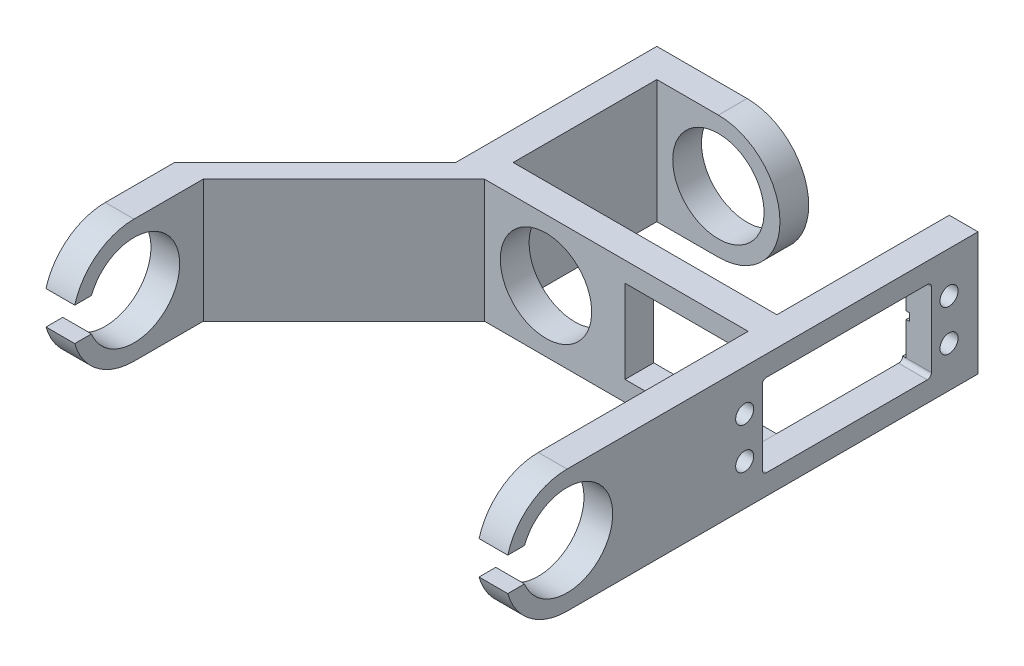
from build123d import *

# Parameters (mm, degrees)
SKETCH1_W               = 7
SKETCH1_H               = 2
SKETCH1_H_2             = 22.25
BOSS_EXTRUDE1_DEPTH     = 15
CUT_EXTRUDE1_DEPTH      = 129.379320765
CUT_EXTRUDE1_DEPTH_BACK = 129.379320765
SKETCH2_R               = 11.125
SKETCH3_R               = 11.125
CUT_EXTRUDE2_DEPTH      = 7
SKETCH6_W               = 30
SKETCH6_H               = 20.3
CUT_EXTRUDE3_DEPTH      = 7
SKETCH7_R               = 2.2
CUT_EXTRUDE4_DEPTH      = 10
CAVITY3_START           = 49.25
CAVITY3_DEPTH           = 0.842
CAVITY3_2_DEPTH         = 6.6275
CAVITY3_START_2         = 55.8775
CAVITY3_3_DEPTH         = 0.3725
CAVITY3_START_3         = -0.9135
CAVITY3_4_DEPTH         = 1.827
CUT_EXTRUDE5_DEPTH      = 10
CUT_EXTRUDE6_DEPTH      = 0.842
CUT_EXTRUDE7_START      = -7.105
SKETCH10_W              = 0.812
SKETCH10_H              = 1.827
CUT_EXTRUDE7_DEPTH      = 7.105
SKETCH11_W              = 7
SKETCH11_H              = 30
BOSS_EXTRUDE2_DEPTH     = 42
CAVITY4_START           = 49.25
CAVITY4_DEPTH           = 7
CAVITY4_2_DEPTH         = 6.6275
CAVITY4_3_DEPTH         = 0.842
CAVITY4_START_2         = -0.9135
CAVITY4_4_DEPTH         = 1.827
CUT_EXTRUDE8_DEPTH      = 42
MIRROR3_COPY_1_SKETCH_R = 2.2
MIRROR3_COPY_1_DEPTH    = 10
MIRROR3_COPY_2_SKETCH_R = 2.2
MIRROR3_COPY_2_DEPTH    = 10
MIRROR3_COPY_3_DEPTH    = 0.842
CUT_EXTRUDE9_DEPTH      = 42
BOSS_EXTRUDE3_DEPTH     = 30
SKETCH15_R              = 11.125
BOSS_EXTRUDE4_DEPTH     = 7
BOSS_EXTRUDE5_REACH     = 131.007
SKETCH16_W              = 7
SKETCH16_H              = 30
SKETCH17_W              = 9.798681855
SKETCH17_H              = 8.1
CUT_EXTRUDE10_DEPTH     = 153.595052344


with BuildPart() as part:
    # Sketch1 → Boss-Extrude1 (new, symmetric)
    with BuildSketch(Plane(origin=(0, 0, 0), x_dir=(1, 0, 0), z_dir=(0, 1, 0))):
        with Locations((-52.75, -12.125)):
            Rectangle(SKETCH1_W, SKETCH1_H)
        with Locations((-52.75, 0)):
            Rectangle(SKETCH1_W, SKETCH1_H_2)
        Polygon((-49.25, 11.125), (-49.25, 53), (49.25, 53), (49.25, 11.125), (56.25, 11.125), (56.25, 60), (-56.25, 60), (-56.25, 11.125), align=None)
        with Locations((52.75, 0)):
            Rectangle(SKETCH1_W, SKETCH1_H_2)
        with Locations((52.75, -12.125)):
            Rectangle(SKETCH1_W, SKETCH1_H)
    extrude(amount=BOSS_EXTRUDE1_DEPTH, both=True)

    # Sketch2 → Cut-Extrude1 (cut, two sides: drawn at the far end of the back side and taken through both)
    with BuildSketch(Plane.ZY.offset(56.25).offset(-CUT_EXTRUDE1_DEPTH_BACK)):
        with Locations((-1.875, 0)):
            Circle(SKETCH2_R)
        with BuildLine():
            Line((13.125, 15), (-1.875, 15))
            ThreePointArc((-1.875, 15), (8.731601718, 10.606601718), (13.125, 0))
            Line((13.125, 0), (13.125, 15))
        make_face()
        with BuildLine():
            Line((13.125, -15), (13.125, 0))
            ThreePointArc((13.125, 0), (8.731601718, -10.606601718), (-1.875, -15))
            Line((-1.875, -15), (13.125, -15))
        make_face()
    extrude(amount=CUT_EXTRUDE1_DEPTH + CUT_EXTRUDE1_DEPTH_BACK, mode=Mode.SUBTRACT)

    # Sketch3 → Cut-Extrude2 (cut)
    with BuildSketch(Plane(origin=(0, 0, -60), x_dir=(-1, 0, 0), z_dir=(0, 0, -1))):
        Circle(SKETCH3_R)
    extrude(amount=-CUT_EXTRUDE2_DEPTH, mode=Mode.SUBTRACT)

    # Sketch6 → Cut-Extrude3 (cut)
    with BuildSketch(Plane(origin=(0, 0, -60), x_dir=(-1, 0, 0), z_dir=(0, 0, -1))):
        with Locations((-34.25, 0)):
            Rectangle(SKETCH6_W, SKETCH6_H)
    extrude(amount=-CUT_EXTRUDE3_DEPTH, mode=Mode.SUBTRACT)

    # Sketch7 → Cut-Extrude4 (cut)
    with BuildSketch(Plane.ZY.offset(-49.25)):
        with Locations((-45.160353728, 5)):
            Circle(SKETCH7_R)
    cut_extrude4 = extrude(amount=-CUT_EXTRUDE4_DEPTH, mode=Mode.SUBTRACT)

    # Cavity3: read off the stored shape, not the designer's step
    # Cavity3 outline → Cavity3 (cut)
    with BuildSketch(Plane.YZ.offset(CAVITY3_START)):
        with BuildLine():
            Line((-3.80625, -42.340467029), (-3.80625, -42.949467029))
            ThreePointArc((-3.80625, -42.949467029), (-5.075, -47.020009529), (-6.34375, -42.949467029))
            Line((-6.34375, -42.949467029), (-6.34375, -42.340467029))
            Line((-6.34375, -42.340467029), (-8.0185, -42.340467029))
            ThreePointArc((-8.0185, -42.340467029), (-8.736213383, -42.637753646), (-9.0335, -43.355467029))
            Line((-9.0335, -43.355467029), (-9.0335, -49.445467029))
            Line((-9.0335, -49.445467029), (9.0335, -49.445467029))
            Line((9.0335, -49.445467029), (9.0335, -43.355467029))
            ThreePointArc((9.0335, -43.355467029), (8.736213383, -42.637753646), (8.0185, -42.340467029))
            Line((8.0185, -42.340467029), (6.34375, -42.340467029))
            Line((6.34375, -42.340467029), (6.34375, -42.949467029))
            ThreePointArc((6.34375, -42.949467029), (7.209542976, -44.131254024), (7.156577631, -45.595293863))
            ThreePointArc((7.156577631, -45.595293863), (4.566705044, -47.317262507), (2.842761328, -44.728704204))
            ThreePointArc((2.842761328, -44.728704204), (3.111418667, -43.723695206), (3.80625, -42.949467029))
            Line((3.80625, -42.949467029), (3.80625, -42.340467029))
            Line((3.80625, -42.340467029), (-3.80625, -42.340467029))
        make_face()
    extrude(amount=CAVITY3_DEPTH, mode=Mode.SUBTRACT)

    # Cavity3 2 outline → Cavity3 2 (cut)
    with BuildSketch(Plane.YZ.offset(CAVITY3_START)):
        with BuildLine():
            ThreePointArc((10.0485, -50.460467029), (9.751213383, -49.742753646), (9.0335, -49.445467029))
            Line((9.0335, -49.445467029), (-9.0335, -49.445467029))
            ThreePointArc((-9.0335, -49.445467029), (-9.751213383, -49.742753646), (-10.0485, -50.460467029))
            Line((-10.0485, -50.460467029), (-10.0485, -60))
            Line((-10.0485, -60), (10.0485, -60))
            Line((10.0485, -60), (10.0485, -50.460467029))
        make_face()
    extrude(amount=CAVITY3_2_DEPTH, mode=Mode.SUBTRACT)

    # Cavity3 3 outline → Cavity3 3 (cut)
    with BuildSketch(Plane.YZ.offset(CAVITY3_START_2)):
        with BuildLine():
            Line((-9.744, -60), (9.744, -60))
            Line((9.744, -60), (9.744, -50.511217029))
            ThreePointArc((9.744, -50.511217029), (9.521035037, -49.972931992), (8.98275, -49.749967029))
            Line((8.98275, -49.749967029), (-8.98275, -49.749967029))
            ThreePointArc((-8.98275, -49.749967029), (-9.521035037, -49.972931992), (-9.744, -50.511217029))
            Line((-9.744, -50.511217029), (-9.744, -60))
        make_face()
    extrude(amount=CAVITY3_3_DEPTH, mode=Mode.SUBTRACT)

    # Cavity3 4 outline → Cavity3 4 (cut)
    with BuildSketch(Plane(origin=(0, 0, 0), x_dir=(1, 0, 0), z_dir=(0, 1, 0)).offset(CAVITY3_START_3)):
        Polygon((50.092, 49.445467029), (50.092, 42.340467029), (50.904, 49.445467029), align=None)
    extrude(amount=CAVITY3_4_DEPTH, mode=Mode.SUBTRACT)

    # Mirror1: Cut-Extrude4 across plane
    add(cut_extrude4.mirror(Plane.ZX), mode=Mode.SUBTRACT)

    # Sketch8 → Cut-Extrude5 (cut)
    with BuildSketch(Plane.ZY.offset(-55.8775)):
        with BuildLine():
            Line((-60, -10.0485), (-50.460467029, -10.0485))
            ThreePointArc((-50.460467029, -10.0485), (-49.742753646, -9.751213383), (-49.445467029, -9.0335))
            Line((-49.445467029, -9.0335), (-49.445467029, 9.0335))
            ThreePointArc((-49.445467029, 9.0335), (-49.742753646, 9.751213383), (-50.460467029, 10.0485))
            Line((-50.460467029, 10.0485), (-60, 10.0485))
            Line((-60, 10.0485), (-60, 9.744))
            Line((-60, 9.744), (-50.511217029, 9.744))
            ThreePointArc((-50.511217029, 9.744), (-49.972931992, 9.521035037), (-49.749967029, 8.98275))
            Line((-49.749967029, 8.98275), (-49.749967029, -8.98275))
            ThreePointArc((-49.749967029, -8.98275), (-49.972931992, -9.521035037), (-50.511217029, -9.744))
            Line((-50.511217029, -9.744), (-60, -9.744))
            Line((-60, -9.744), (-60, -10.0485))
        make_face()
    cut_extrude5 = extrude(amount=-CUT_EXTRUDE5_DEPTH, mode=Mode.SUBTRACT)

    # Sketch9 → Cut-Extrude6 (cut)
    with BuildSketch(Plane.ZY.offset(-49.25)):
        with BuildLine():
            Line((-42.340467029, 6.34375), (-42.340467029, 3.80625))
            Line((-42.340467029, 3.80625), (-42.949467029, 3.80625))
            ThreePointArc((-42.949467029, 3.80625), (-43.723695206, 3.111418667), (-44.728704204, 2.842761328))
            ThreePointArc((-44.728704204, 2.842761328), (-43.003444949, 5.433294956), (-45.595293863, 7.156577631))
            ThreePointArc((-45.595293863, 7.156577631), (-44.131254024, 7.209542976), (-42.949467029, 6.34375))
            Line((-42.949467029, 6.34375), (-42.340467029, 6.34375))
        make_face()
    cut_extrude6 = extrude(amount=-CUT_EXTRUDE6_DEPTH, mode=Mode.SUBTRACT)

    # Mirror2: Cut-Extrude6 across plane
    add(cut_extrude6.mirror(Plane.ZX), mode=Mode.SUBTRACT)

    # Sketch10 → Cut-Extrude7 (cut)
    with BuildSketch(Plane(origin=(0, 0, -49.445467029), x_dir=(-1, 0, 0), z_dir=(0, 0, -1)).offset(CUT_EXTRUDE7_START)):
        with Locations((-50.498, 0)):
            Rectangle(SKETCH10_W, SKETCH10_H)
    cut_extrude7 = extrude(amount=CUT_EXTRUDE7_DEPTH, mode=Mode.SUBTRACT)

    # Sketch11 → Boss-Extrude2 (add)
    with BuildSketch(Plane(origin=(0, 0, -60), x_dir=(-1, 0, 0), z_dir=(0, 0, -1))):
        with Locations((-52.75, 0)):
            Rectangle(SKETCH11_W, SKETCH11_H)
    extrude(amount=BOSS_EXTRUDE2_DEPTH)

    # Cavity4: read off the stored shape, not the designer's step
    # Cavity4 outline → Cavity4 (cut)
    with BuildSketch(Plane.YZ.offset(CAVITY4_START)):
        with BuildLine():
            Line((9.744, -60), (-9.744, -60))
            Line((-9.744, -60), (-9.744, -89.588717029))
            ThreePointArc((-9.744, -89.588717029), (-9.521035037, -90.127002066), (-8.98275, -90.349967029))
            Line((-8.98275, -90.349967029), (8.98275, -90.349967029))
            ThreePointArc((8.98275, -90.349967029), (9.521035037, -90.127002066), (9.744, -89.588717029))
            Line((9.744, -89.588717029), (9.744, -60))
        make_face()
    extrude(amount=CAVITY4_DEPTH, mode=Mode.SUBTRACT)

    # Cavity4 2 outline → Cavity4 2 (cut)
    with BuildSketch(Plane.YZ.offset(CAVITY4_START)):
        with BuildLine():
            Line((-9.0335, -90.654467029), (9.0335, -90.654467029))
            ThreePointArc((9.0335, -90.654467029), (9.751213383, -90.357180412), (10.0485, -89.639467029))
            Line((10.0485, -89.639467029), (10.0485, -60))
            Line((10.0485, -60), (9.744, -60))
            Line((9.744, -60), (9.744, -89.588717029))
            ThreePointArc((9.744, -89.588717029), (9.521035037, -90.127002066), (8.98275, -90.349967029))
            Line((8.98275, -90.349967029), (-8.98275, -90.349967029))
            ThreePointArc((-8.98275, -90.349967029), (-9.521035037, -90.127002066), (-9.744, -89.588717029))
            Line((-9.744, -89.588717029), (-9.744, -60))
            Line((-9.744, -60), (-10.0485, -60))
            Line((-10.0485, -60), (-10.0485, -89.639467029))
            ThreePointArc((-10.0485, -89.639467029), (-9.751213383, -90.357180412), (-9.0335, -90.654467029))
        make_face()
    extrude(amount=CAVITY4_2_DEPTH, mode=Mode.SUBTRACT)

    # Cavity4 3 outline → Cavity4 3 (cut)
    with BuildSketch(Plane.YZ.offset(CAVITY4_START)):
        with BuildLine():
            Line((-9.0335, -90.654467029), (-9.0335, -96.744467029))
            ThreePointArc((-9.0335, -96.744467029), (-8.736213383, -97.462180412), (-8.0185, -97.759467029))
            Line((-8.0185, -97.759467029), (-6.34375, -97.759467029))
            Line((-6.34375, -97.759467029), (-6.34375, -97.150467029))
            ThreePointArc((-6.34375, -97.150467029), (-5.075, -93.07992453), (-3.80625, -97.150467029))
            Line((-3.80625, -97.150467029), (-3.80625, -97.759467029))
            Line((-3.80625, -97.759467029), (3.80625, -97.759467029))
            Line((3.80625, -97.759467029), (3.80625, -97.150467029))
            ThreePointArc((3.80625, -97.150467029), (5.075, -93.07992453), (6.34375, -97.150467029))
            Line((6.34375, -97.150467029), (6.34375, -97.759467029))
            Line((6.34375, -97.759467029), (8.0185, -97.759467029))
            ThreePointArc((8.0185, -97.759467029), (8.736213383, -97.462180412), (9.0335, -96.744467029))
            Line((9.0335, -96.744467029), (9.0335, -90.654467029))
            Line((9.0335, -90.654467029), (-9.0335, -90.654467029))
        make_face()
    extrude(amount=CAVITY4_3_DEPTH, mode=Mode.SUBTRACT)

    # Cavity4 4 outline → Cavity4 4 (cut)
    with BuildSketch(Plane(origin=(0, 0, 0), x_dir=(1, 0, 0), z_dir=(0, 1, 0)).offset(CAVITY4_START_2)):
        Polygon((50.904, 90.654467029), (50.092, 97.759467029), (50.092, 90.654467029), align=None)
    extrude(amount=CAVITY4_4_DEPTH, mode=Mode.SUBTRACT)

    # Sketch12 → Cut-Extrude8 (cut)
    with BuildSketch(Plane.ZY.offset(-55.8775)):
        with BuildLine():
            Line((-60, 10.0485), (-89.639467029, 10.0485))
            ThreePointArc((-89.639467029, 10.0485), (-90.357180412, 9.751213383), (-90.654467029, 9.0335))
            Line((-90.654467029, 9.0335), (-90.654467029, -9.0335))
            ThreePointArc((-90.654467029, -9.0335), (-90.357180412, -9.751213383), (-89.639467029, -10.0485))
            Line((-89.639467029, -10.0485), (-60, -10.0485))
            Line((-60, -10.0485), (-60, -9.744))
            Line((-60, -9.744), (-89.588717029, -9.744))
            ThreePointArc((-89.588717029, -9.744), (-90.127002066, -9.521035037), (-90.349967029, -8.98275))
            Line((-90.349967029, -8.98275), (-90.349967029, 8.98275))
            ThreePointArc((-90.349967029, 8.98275), (-90.127002066, 9.521035037), (-89.588717029, 9.744))
            Line((-89.588717029, 9.744), (-60, 9.744))
            Line((-60, 9.744), (-60, 10.0485))
        make_face()
    extrude(amount=-CUT_EXTRUDE8_DEPTH, mode=Mode.SUBTRACT)

    # Mirror3: Cut-Extrude5, Cut-Extrude6, Cut-Extrude7 across plane
    add(cut_extrude5.mirror(Plane(origin=(0, 0, -70.049967029), x_dir=(1, 0, 0), z_dir=(0, 0, -1))), mode=Mode.SUBTRACT)
    add(cut_extrude6.mirror(Plane(origin=(0, 0, -70.049967029), x_dir=(1, 0, 0), z_dir=(0, 0, -1))), mode=Mode.SUBTRACT)
    add(cut_extrude7.mirror(Plane(origin=(0, 0, -70.049967029), x_dir=(1, 0, 0), z_dir=(0, 0, -1))), mode=Mode.SUBTRACT)

    # Mirror3 copy 1 sketch → Mirror3 copy 1 (cut)
    with BuildSketch(Plane(origin=(49.25, 0, -140.099934058), x_dir=(0, 0, -1), z_dir=(-1, 0, 0))):
        with Locations((-45.160353728, 5)):
            Circle(MIRROR3_COPY_1_SKETCH_R)
    extrude(amount=-MIRROR3_COPY_1_DEPTH, mode=Mode.SUBTRACT)

    # Mirror3 copy 2 sketch → Mirror3 copy 2 (cut)
    with BuildSketch(Plane(origin=(49.25, 0, -140.099934058), x_dir=(0, 0, -1), z_dir=(-1, 0, 0))):
        with Locations((-45.160353728, -5)):
            Circle(MIRROR3_COPY_2_SKETCH_R)
    extrude(amount=-MIRROR3_COPY_2_DEPTH, mode=Mode.SUBTRACT)

    # Mirror3 copy 3 sketch → Mirror3 copy 3 (cut)
    with BuildSketch(Plane(origin=(49.25, 0, -140.099934058), x_dir=(0, 0, -1), z_dir=(-1, 0, 0))):
        with BuildLine():
            Line((-42.340467029, 6.34375), (-42.340467029, 3.80625))
            Line((-42.340467029, 3.80625), (-42.949467029, 3.80625))
            ThreePointArc((-42.949467029, 3.80625), (-43.723695206, 3.111418667), (-44.728704204, 2.842761328))
            ThreePointArc((-44.728704204, 2.842761328), (-43.003444949, 5.433294956), (-45.595293863, 7.156577631))
            ThreePointArc((-45.595293863, 7.156577631), (-44.131254024, 7.209542976), (-42.949467029, 6.34375))
            Line((-42.949467029, 6.34375), (-42.340467029, 6.34375))
        make_face()
    extrude(amount=-MIRROR3_COPY_3_DEPTH, mode=Mode.SUBTRACT)

    # Sketch13 → Cut-Extrude9 (cut)
    with BuildSketch(Plane(origin=(0, 15, 0), x_dir=(1, 0, 0), z_dir=(0, 1, 0))):
        Polygon((-56.25, 60), (-56.25, 18.75), (-15, 60), align=None)
    extrude(amount=-CUT_EXTRUDE9_DEPTH, mode=Mode.SUBTRACT)


with BuildPart() as cut_extrude9_piece_1:
    # of the separate pieces the step leaves, piece 1, a body of its own (cut_extrude9_pieces)
    add(part.part.solids().sort_by_distance((49.25, 15, -60))[0])



with BuildPart() as cut_extrude9_piece_2:
    # of the separate pieces the step leaves, piece 2, a body of its own (cut_extrude9_pieces)
    add(part.part.solids().sort_by_distance((-56.25, 15, -1.875))[0])


with BuildPart() as cut_extrude9_piece_1_1:
    add(cut_extrude9_piece_1.part)

    add(cut_extrude9_piece_2.part)  # Boss-Extrude3 merges Cut-Extrude9 piece 2
    # Sketch13<3> → Boss-Extrude3 (add)
    with BuildSketch(Plane(origin=(0, 15, 0), x_dir=(1, 0, 0), z_dir=(0, 1, 0))):
        Polygon((-49.25, 25.75), (-49.25, 18.75), (-15, 53), (-22, 53), align=None)
    extrude(amount=-BOSS_EXTRUDE3_DEPTH)



with BuildPart() as body_2:
    # Sketch15 → Boss-Extrude4 (new body)
    with BuildSketch(Plane(origin=(0, 0, -102), x_dir=(-1, 0, 0), z_dir=(0, 0, -1))):
        with BuildLine():
            Line((0, 15), (15, 15))
            Line((15, 15), (15, -15))
            Line((15, -15), (0, -15))
            ThreePointArc((0, -15), (-15, 0), (0, 15))
        make_face()
        Circle(SKETCH15_R, mode=Mode.SUBTRACT)
    extrude(amount=-BOSS_EXTRUDE4_DEPTH)


with BuildPart() as cut_extrude9_piece_1_2:
    add(cut_extrude9_piece_1_1.part)

    add(body_2.part)  # Boss-Extrude5 merges body 2
    # Boss-Extrude5: up to this plane
    boss_extrude5_end = Plane(origin=(-37.5, -27, -37.5), z_dir=(0.7071067811865447, 0, 0.7071067811865505))
    # Sketch16 → Boss-Extrude5 (add, up to the surface)
    with BuildSketch(Plane(origin=(0, 0, -102), x_dir=(-1, 0, 0), z_dir=(0, 0, -1)), mode=Mode.PRIVATE) as boss_extrude5_sk1:
        with Locations((18.5, 0)):
            Rectangle(SKETCH16_W, SKETCH16_H)
    boss_extrude5_tool1 = split(extrude(boss_extrude5_sk1.sketch, amount=-BOSS_EXTRUDE5_REACH, mode=Mode.PRIVATE), bisect_by=boss_extrude5_end, keep=Keep.BOTH, mode=Mode.PRIVATE)
    add(boss_extrude5_tool1.solids().sort_by_distance((-18.5, 0, -102))[0])

    # Sketch17 → Cut-Extrude10 (cut, through all)
    with BuildSketch(Plane.ZY.offset(56.25)):
        with Locations((8.225659073, 0)):
            Rectangle(SKETCH17_W, SKETCH17_H)
    extrude(amount=-CUT_EXTRUDE10_DEPTH, mode=Mode.SUBTRACT)


solid = cut_extrude9_piece_1_2.part
